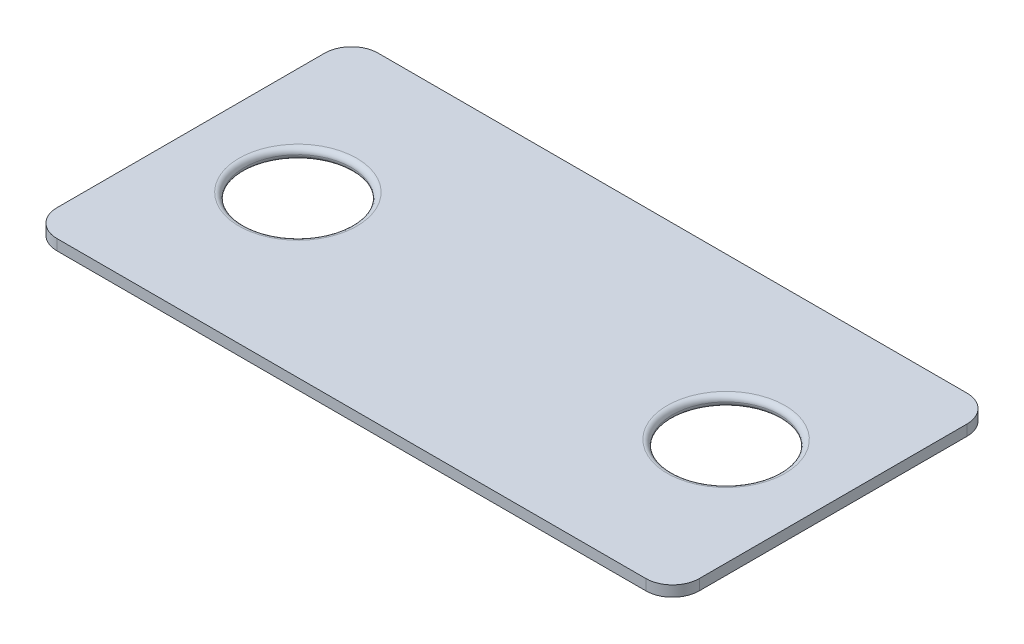
from build123d import *

# Parameters (mm, degrees)
SKETCH1_R          = 10
BASE_FLANGE1_DEPTH = 2
FILLET1_R          = 1
FILLET2_R          = 1
FILLET3_R          = 1


# Sheet-metal steps are written as plain solids
with BuildPart() as part:
    # Sketch1 → Base-Flange1 (new body)
    with BuildSketch(Plane(origin=(0, 0, 0), x_dir=(1, 0, 0), z_dir=(0, 1, 0))):
        with BuildLine():
            Line((55, -30), (-55, -30))
            ThreePointArc((-55, -30), (-58.535533906, -28.535533906), (-60, -25))
            Line((-60, -25), (-60, 25))
            ThreePointArc((-60, 25), (-58.535533906, 28.535533906), (-55, 30))
            Line((-55, 30), (55, 30))
            ThreePointArc((55, 30), (58.535533906, 28.535533906), (60, 25))
            Line((60, 25), (60, -25))
            ThreePointArc((60, -25), (58.535533906, -28.535533906), (55, -30))
        make_face()
        with Locations(Location((-40, 0, 0), (0, 0, 270))):
            Circle(SKETCH1_R, mode=Mode.SUBTRACT)
        with Locations(Location((40, 0, 0), (0, 0, 270))):
            Circle(SKETCH1_R, mode=Mode.SUBTRACT)
    extrude(amount=-BASE_FLANGE1_DEPTH)

    # Fillet1
    fillet1_edges = [part.edges().sort_by_distance(p)[0] for p in [
        (-40, 0, -10),
        (40, 0, -10),
    ]]
    fillet(fillet1_edges, radius=FILLET1_R)

    # Fillet2
    fillet2_edges = [part.edges().sort_by_distance(p)[0] for p in [
        (-40, -2, -10),
    ]]
    fillet(fillet2_edges, radius=FILLET2_R - 0.0001)  # a hair under: the kernel refuses the full size

    # Fillet3
    fillet3_edges = [part.edges().sort_by_distance(p)[0] for p in [
        (40, -2, -10),
    ]]
    fillet(fillet3_edges, radius=FILLET3_R - 0.0001)  # a hair under: the kernel refuses the full size


solid = part.part
